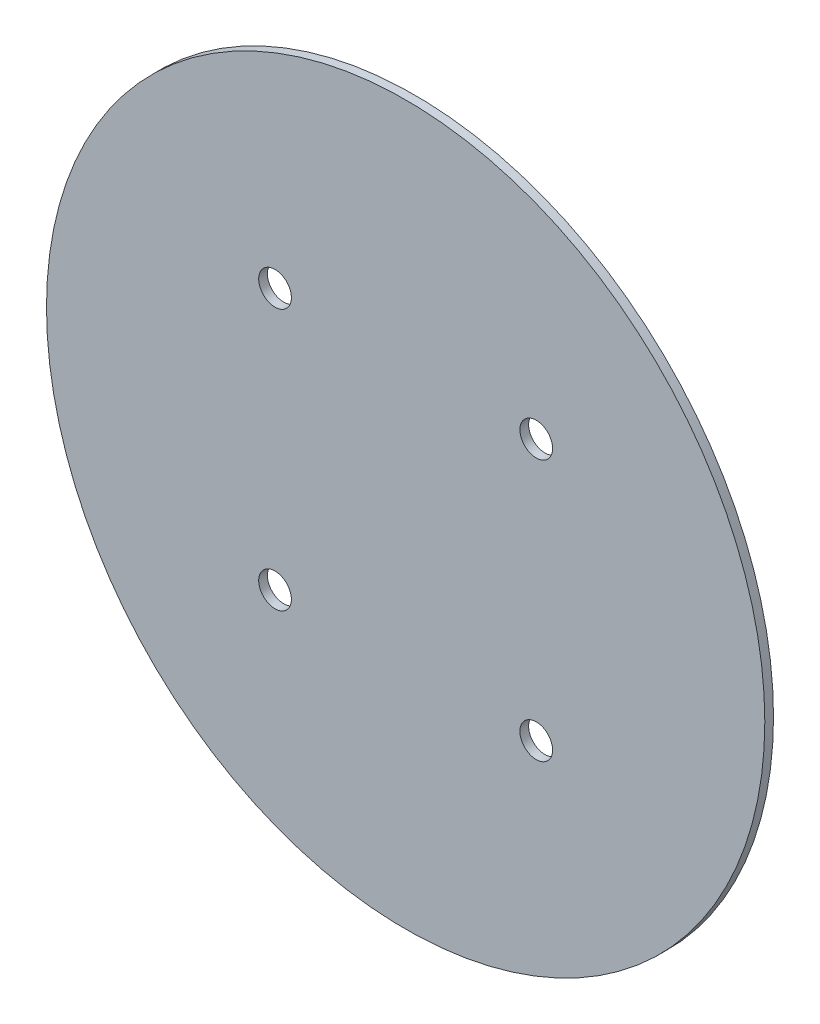
from build123d import *

# Parameters (mm, degrees)
SKETCH_1_R          = 82.5
EXTRUDE_1_DEPTH     = 2
SKETCH_2_R          = 3.755
CUT_EXTRUDE_1_DEPTH = 117.689759619


with BuildPart() as part:
    # 草图1 → 凸台-拉伸1 (new body)
    with BuildSketch(Plane.XY):
        Circle(SKETCH_1_R)
    extrude(amount=EXTRUDE_1_DEPTH)

    # 草图2 → 切除-拉伸1 (cut, through all)
    with BuildSketch(Plane.XY.offset(2)):
        with Locations((30, 30)):
            Circle(SKETCH_2_R)
        with Locations((-30, 30)):
            Circle(SKETCH_2_R)
        with Locations((-30, -30)):
            Circle(SKETCH_2_R)
        with Locations((30, -30)):
            Circle(SKETCH_2_R)
    extrude(amount=-CUT_EXTRUDE_1_DEPTH, mode=Mode.SUBTRACT)


solid = part.part
